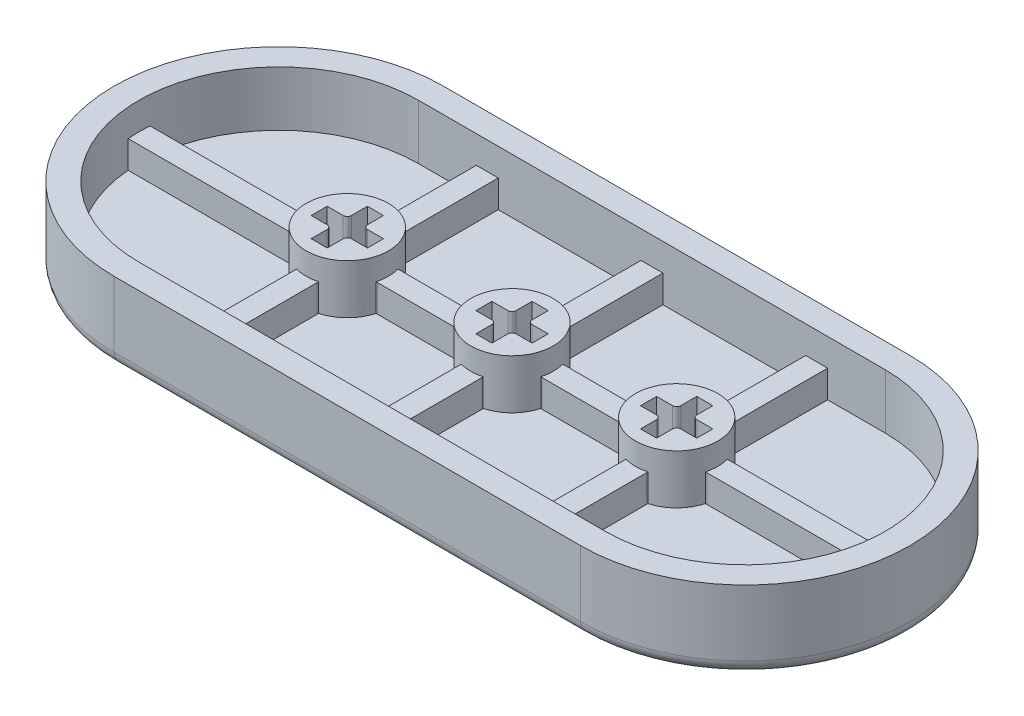
from build123d import *

# Parameters (mm, degrees)
BUTTON_TOP_DEPTH    = 1.8
BUTTON_WALLS_DEPTH  = 4
SKETCH3_R           = 3
STEM_HOUSING_DEPTH  = 3.6
BOSS_EXTRUDE4_DEPTH = 2
FILLET1_R           = 1


with BuildPart() as part:
    # Sketch1 → button top (new body)
    with BuildSketch(Plane(origin=(0, 0, 0), x_dir=(1, 0, 0), z_dir=(0, 1, 0))):
        with BuildLine():
            Line((17, -12), (-17, -12))
            ThreePointArc((-17, -12), (-29, 0), (-17, 12))
            Line((-17, 12), (17, 12))
            ThreePointArc((17, 12), (29, 0), (17, -12))
        make_face()
    extrude(amount=BUTTON_TOP_DEPTH)

    # Sketch2 → button walls (add)
    with BuildSketch(Plane(origin=(0, 1.8, 0), x_dir=(1, 0, 0), z_dir=(0, 1, 0))):
        with BuildLine():
            Line((-17, 12), (17, 12))
            ThreePointArc((17, 12), (29, 0), (17, -12))
            Line((17, -12), (-17, -12))
            ThreePointArc((-17, -12), (-29, 0), (-17, 12))
        make_face()
        with BuildLine():
            Line((-17, 10.2), (17, 10.2))
            ThreePointArc((17, 10.2), (27.2, 0), (17, -10.2))
            Line((17, -10.2), (-17, -10.2))
            ThreePointArc((-17, -10.2), (-27.2, 0), (-17, 10.2))
        make_face(mode=Mode.SUBTRACT)
    extrude(amount=BUTTON_WALLS_DEPTH)

    # Sketch3 → stem housing (add)
    # profile 1 of 3: a face of its own
    with BuildSketch(Plane(origin=(0, 1.8, 0), x_dir=(1, 0, 0), z_dir=(0, 1, 0))):
        Circle(SKETCH3_R)
        with BuildLine():
            Line((-0.585, 0.885), (-0.585, 2.05))
            Line((-0.585, 2.05), (0.585, 2.05))
            Line((0.585, 2.05), (0.585, 0.885))
            ThreePointArc((0.585, 0.885), (0.672867966, 0.672867966), (0.885, 0.585))
            Line((0.885, 0.585), (2.05, 0.585))
            Line((2.05, 0.585), (2.05, -0.585))
            Line((2.05, -0.585), (0.885, -0.585))
            ThreePointArc((0.885, -0.585), (0.672867966, -0.672867966), (0.585, -0.885))
            Line((0.585, -0.885), (0.585, -2.05))
            Line((0.585, -2.05), (-0.585, -2.05))
            Line((-0.585, -2.05), (-0.585, -0.885))
            ThreePointArc((-0.585, -0.885), (-0.672867966, -0.672867966), (-0.885, -0.585))
            Line((-0.885, -0.585), (-2.05, -0.585))
            Line((-2.05, -0.585), (-2.05, 0.585))
            Line((-2.05, 0.585), (-0.885, 0.585))
            ThreePointArc((-0.885, 0.585), (-0.672867966, 0.672867966), (-0.585, 0.885))
        make_face(mode=Mode.SUBTRACT)
    # profile 2 of 3: a face of its own
    with BuildSketch(Plane(origin=(0, 1.8, 0), x_dir=(1, 0, 0), z_dir=(0, 1, 0))):
        with Locations((12, 0)):
            Circle(SKETCH3_R)
        with BuildLine():
            Line((11.415, 0.885), (11.415, 2.05))
            Line((11.415, 2.05), (12.585, 2.05))
            Line((12.585, 2.05), (12.585, 0.885))
            ThreePointArc((12.585, 0.885), (12.672867966, 0.672867966), (12.885, 0.585))
            Line((12.885, 0.585), (14.05, 0.585))
            Line((14.05, 0.585), (14.05, -0.585))
            Line((14.05, -0.585), (12.885, -0.585))
            ThreePointArc((12.885, -0.585), (12.672867966, -0.672867966), (12.585, -0.885))
            Line((12.585, -0.885), (12.585, -2.05))
            Line((12.585, -2.05), (11.415, -2.05))
            Line((11.415, -2.05), (11.415, -0.885))
            ThreePointArc((11.415, -0.885), (11.327132034, -0.672867966), (11.115, -0.585))
            Line((11.115, -0.585), (9.95, -0.585))
            Line((9.95, -0.585), (9.95, 0.585))
            Line((9.95, 0.585), (11.115, 0.585))
            ThreePointArc((11.115, 0.585), (11.327132034, 0.672867966), (11.415, 0.885))
        make_face(mode=Mode.SUBTRACT)
    # profile 3 of 3: a face of its own
    with BuildSketch(Plane(origin=(0, 1.8, 0), x_dir=(1, 0, 0), z_dir=(0, 1, 0))):
        with Locations((-12, 0)):
            Circle(SKETCH3_R)
        with BuildLine():
            Line((-12.585, 0.885), (-12.585, 2.05))
            Line((-12.585, 2.05), (-11.415, 2.05))
            Line((-11.415, 2.05), (-11.415, 0.885))
            ThreePointArc((-11.415, 0.885), (-11.327132034, 0.672867966), (-11.115, 0.585))
            Line((-11.115, 0.585), (-9.95, 0.585))
            Line((-9.95, 0.585), (-9.95, -0.585))
            Line((-9.95, -0.585), (-11.115, -0.585))
            ThreePointArc((-11.115, -0.585), (-11.327132034, -0.672867966), (-11.415, -0.885))
            Line((-11.415, -0.885), (-11.415, -2.05))
            Line((-11.415, -2.05), (-12.585, -2.05))
            Line((-12.585, -2.05), (-12.585, -0.885))
            ThreePointArc((-12.585, -0.885), (-12.672867966, -0.672867966), (-12.885, -0.585))
            Line((-12.885, -0.585), (-14.05, -0.585))
            Line((-14.05, -0.585), (-14.05, 0.585))
            Line((-14.05, 0.585), (-12.885, 0.585))
            ThreePointArc((-12.885, 0.585), (-12.672867966, 0.672867966), (-12.585, 0.885))
        make_face(mode=Mode.SUBTRACT)
    extrude(amount=STEM_HOUSING_DEPTH)

    # Sketch4 → Boss-Extrude4 (add)
    with BuildSketch(Plane(origin=(0, 1.8, 0), x_dir=(1, 0, 0), z_dir=(0, 1, 0))):
        with BuildLine():
            Line((-0.8, 3), (-0.8, 10.2))
            ThreePointArc((-0.8, 10.2), (0, 11), (0.8, 10.2))
            Line((0.8, 10.2), (0.8, 3))
            ThreePointArc((0.8, 3), (0, 2.2), (-0.8, 3))
        make_face()
        with BuildLine():
            Line((9, 0.8), (3, 0.8))
            ThreePointArc((3, 0.8), (2.2, 0), (3, -0.8))
            Line((3, -0.8), (9, -0.8))
            ThreePointArc((9, -0.8), (9.8, 0), (9, 0.8))
        make_face()
        with BuildLine():
            Line((15, -0.8), (27.2, -0.8))
            ThreePointArc((27.2, -0.8), (28, 0), (27.2, 0.8))
            Line((27.2, 0.8), (15, 0.8))
            ThreePointArc((15, 0.8), (14.2, 0), (15, -0.8))
        make_face()
        with BuildLine():
            Line((11.2, 3), (11.2, 10.2))
            ThreePointArc((11.2, 10.2), (12, 11), (12.8, 10.2))
            Line((12.8, 10.2), (12.8, 3))
            ThreePointArc((12.8, 3), (12, 2.2), (11.2, 3))
        make_face()
        with BuildLine():
            Line((-12.8, 3), (-12.8, 10.2))
            ThreePointArc((-12.8, 10.2), (-12, 11), (-11.2, 10.2))
            Line((-11.2, 10.2), (-11.2, 3))
            ThreePointArc((-11.2, 3), (-12, 2.2), (-12.8, 3))
        make_face()
        with BuildLine():
            Line((-15, -0.8), (-27.2, -0.8))
            ThreePointArc((-27.2, -0.8), (-28, 0), (-27.2, 0.8))
            Line((-27.2, 0.8), (-15, 0.8))
            ThreePointArc((-15, 0.8), (-14.2, 0), (-15, -0.8))
        make_face()
        with BuildLine():
            Line((-9, 0.8), (-3, 0.8))
            ThreePointArc((-3, 0.8), (-2.2, 0), (-3, -0.8))
            Line((-3, -0.8), (-9, -0.8))
            ThreePointArc((-9, -0.8), (-9.8, 0), (-9, 0.8))
        make_face()
        with BuildLine():
            Line((-0.8, -3), (-0.8, -10.2))
            ThreePointArc((-0.8, -10.2), (0, -11), (0.8, -10.2))
            Line((0.8, -10.2), (0.8, -3))
            ThreePointArc((0.8, -3), (0, -2.2), (-0.8, -3))
        make_face()
        with BuildLine():
            Line((11.2, -3), (11.2, -10.2))
            ThreePointArc((11.2, -10.2), (12, -11), (12.8, -10.2))
            Line((12.8, -10.2), (12.8, -3))
            ThreePointArc((12.8, -3), (12, -2.2), (11.2, -3))
        make_face()
        with BuildLine():
            Line((-12.8, -3), (-12.8, -10.2))
            ThreePointArc((-12.8, -10.2), (-12, -11), (-11.2, -10.2))
            Line((-11.2, -10.2), (-11.2, -3))
            ThreePointArc((-11.2, -3), (-12, -2.2), (-12.8, -3))
        make_face()
    extrude(amount=BOSS_EXTRUDE4_DEPTH)

    # Fillet1
    fillet1_edges = [part.edges().sort_by_distance(p)[0] for p in [
        (0, 0, -12),
        (-29, 0, 0),
        (0, 0, 12),
        (29, 0, 0),
    ]]
    fillet(fillet1_edges, radius=FILLET1_R)


solid = part.part
